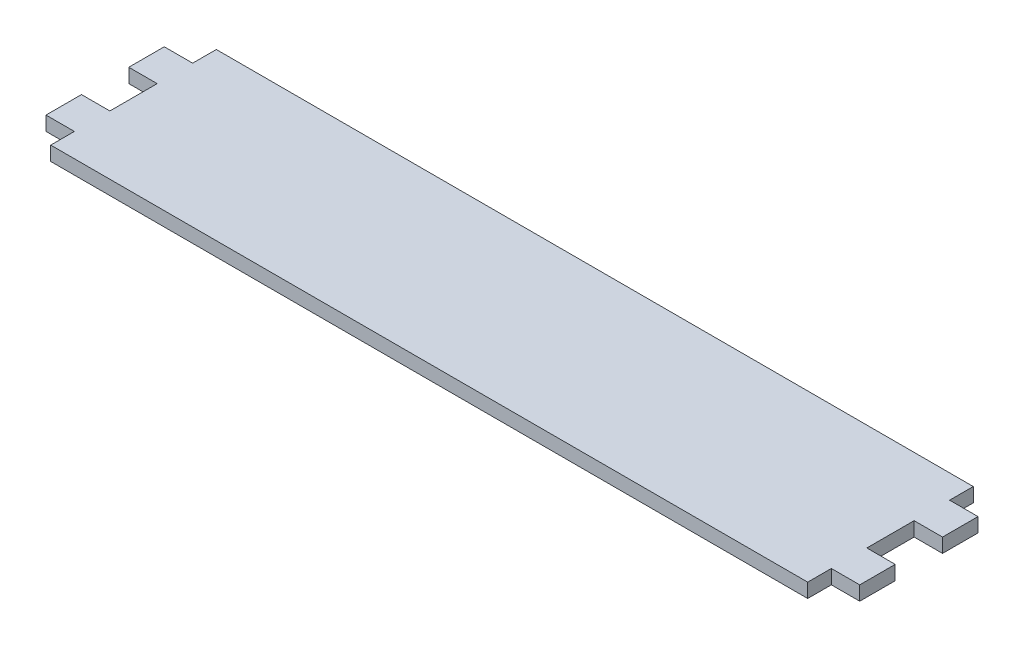
from build123d import *

# Parameters (mm, degrees)
SKIZZE1_W                       = 320
SKIZZE1_H                       = 70
GRUNDFORM_DEPTH                 = 6
SKIZZE3_W                       = 15
SKIZZE3_H                       = 6
AUFSATZ_LINEAR_AUSTRAGEN2_DEPTH = 12


with BuildPart() as part:
    # Skizze1 → Grundform (new body)
    with BuildSketch(Plane(origin=(0, 0, 0), x_dir=(1, 0, 0), z_dir=(0, 1, 0))):
        Rectangle(SKIZZE1_W, SKIZZE1_H)
    extrude(amount=GRUNDFORM_DEPTH)

    # Skizze3 → Aufsatz-Linear austragen2 (add)
    with BuildSketch(Plane.ZY.offset(160)):
        with Locations((-17.5, 3)):
            Rectangle(SKIZZE3_W, SKIZZE3_H)
        with Locations((17.5, 3)):
            Rectangle(SKIZZE3_W, SKIZZE3_H)
    aufsatz_linear_austragen2 = extrude(amount=AUFSATZ_LINEAR_AUSTRAGEN2_DEPTH)

    # Spiegeln1: Aufsatz-Linear austragen2 across plane
    add(aufsatz_linear_austragen2.mirror(Plane(origin=(0, 0, 0), x_dir=(0, 0, 1), z_dir=(1, 0, 0))))


solid = part.part
